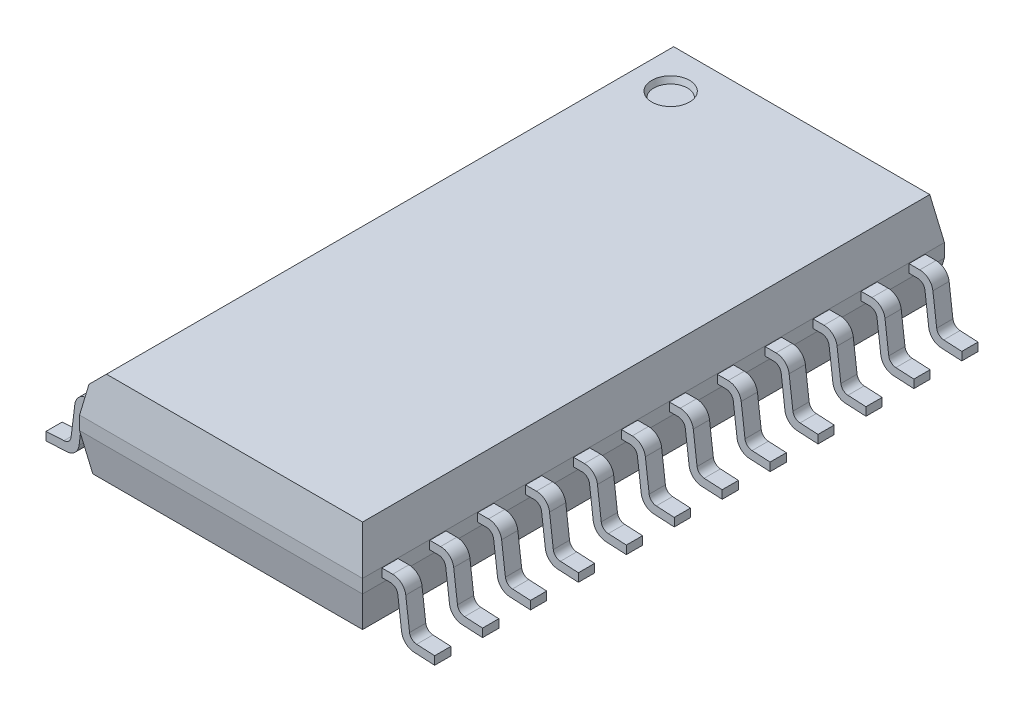
from build123d import *
from OCP.BRepFilletAPI import BRepFilletAPI_MakeChamfer

# Parameters (mm, degrees)
SKETCH1_W            = 7.5
SKETCH1_H            = 15.42
BOSS_EXTRUDE1_DEPTH  = 2.45
CHAMFER1_SIZE        = 0.175
CHAMFER1_SIZE2       = 0.992474318
CHAMFER2_SIZE        = 1.1
CHAMFER2_SIZE2       = 0.193959679
CHAMFER3_SIZE        = 0.4
CHAMFER3_SIZE2       = 0.32446383
SKETCH3_R            = 0.5
MARK_PIN1_DEPTH      = 0.15
MARK_PIN1_DRAFT      = -20
PIN_EXTRUDE_DEPTH    = 0.43
FILLET1_R            = 0.2
FILLET2_R            = 0.35
FILLET1_OF_MIRROR1_R = 0.2
FILLET2_OF_MIRROR1_R = 0.35
PIN_PATTERN_START    = -5.93
PIN_PATTERN_DEPTH    = 0.43
PIN_PATTERN_START_2  = -4.66
PIN_PATTERN_2_DEPTH  = 0.43
PIN_PATTERN_START_3  = -3.39
PIN_PATTERN_3_DEPTH  = 0.43
PIN_PATTERN_START_4  = -2.12
PIN_PATTERN_4_DEPTH  = 0.43
PIN_PATTERN_START_5  = -0.85
PIN_PATTERN_5_DEPTH  = 0.43
PIN_PATTERN_START_6  = 0.42
PIN_PATTERN_6_DEPTH  = 0.43
PIN_PATTERN_START_7  = 1.69
PIN_PATTERN_7_DEPTH  = 0.43
PIN_PATTERN_START_8  = 2.96
PIN_PATTERN_8_DEPTH  = 0.43
PIN_PATTERN_START_9  = 4.23
PIN_PATTERN_9_DEPTH  = 0.43
PIN_PATTERN_START_10 = 5.5
PIN_PATTERN_10_DEPTH = 0.43
PIN_PATTERN_START_11 = 6.77
PIN_PATTERN_11_DEPTH = 0.43


# Read off the part's stored shape, not the designer's step: pin_pattern
with BuildPart() as part:
    # Sketch1 → Boss-Extrude1 (new body)
    with BuildSketch(Plane(origin=(0, 0.2, 0), x_dir=(1, 0, 0), z_dir=(0, 1, 0))):
        Rectangle(SKETCH1_W, SKETCH1_H)
    extrude(amount=BOSS_EXTRUDE1_DEPTH)

    # Chamfer1
    chamfer1_edges = [part.edges().sort_by_distance(p)[0] for p in [
        (0, 0.2, 7.71),
        (-3.75, 0.2, 0),
        (0, 0.2, -7.71),
        (3.75, 0.2, 0),
    ]]
    chamfer1_side = [part.faces().sort_by_distance(p)[0] for p in [
        (0, 0.2, 0),
    ]]
    chamfer(chamfer1_edges, length=CHAMFER1_SIZE, length2=CHAMFER1_SIZE2, reference=chamfer1_side[0])

    # Chamfer2: one chamfer whose edges measure the first distance from different faces: ONE call of the kernel's chamfer builder (chamfer() names one face for all edges)
    chamfer2_edges_1 = [part.edges().sort_by_distance(p)[0] for p in [
        (-3.75, 2.65, 0),
    ]]
    chamfer2_side_1 = [part.faces().sort_by_distance(p)[0] for p in [
        (-3.75, 1.921237159, 0),
    ]]
    chamfer2_edges_2 = [part.edges().sort_by_distance(p)[0] for p in [
        (0, 2.65, 7.71),
    ]]
    chamfer2_side_2 = [part.faces().sort_by_distance(p)[0] for p in [
        (0, 1.921237159, 7.71),
    ]]
    chamfer2_edges_3 = [part.edges().sort_by_distance(p)[0] for p in [
        (3.75, 2.65, 0),
    ]]
    chamfer2_side_3 = [part.faces().sort_by_distance(p)[0] for p in [
        (3.75, 1.921237159, 0),
    ]]
    chamfer2_edges_4 = [part.edges().sort_by_distance(p)[0] for p in [
        (0, 2.65, -7.71),
    ]]
    chamfer2_side_4 = [part.faces().sort_by_distance(p)[0] for p in [
        (0, 1.921237159, -7.71),
    ]]
    chamfer2 = BRepFilletAPI_MakeChamfer(part.part.solid().wrapped)
    for e in chamfer2_edges_1:
        chamfer2.Add(CHAMFER2_SIZE, CHAMFER2_SIZE2, e.wrapped, chamfer2_side_1[0].wrapped)  # the first distance lies on this face
    for e in chamfer2_edges_2:
        chamfer2.Add(CHAMFER2_SIZE, CHAMFER2_SIZE2, e.wrapped, chamfer2_side_2[0].wrapped)  # the first distance lies on this face
    for e in chamfer2_edges_3:
        chamfer2.Add(CHAMFER2_SIZE, CHAMFER2_SIZE2, e.wrapped, chamfer2_side_3[0].wrapped)  # the first distance lies on this face
    for e in chamfer2_edges_4:
        chamfer2.Add(CHAMFER2_SIZE, CHAMFER2_SIZE2, e.wrapped, chamfer2_side_4[0].wrapped)  # the first distance lies on this face
    add(Compound.cast(chamfer2.Shape()), mode=Mode.REPLACE)

    # Chamfer3
    chamfer3_edges = [part.edges().sort_by_distance(p)[0] for p in [
        (-3.556040321, 2.65, 0),
    ]]
    chamfer3_side = [part.faces().sort_by_distance(p)[0] for p in [
        (-3.653431959, 2.097664575, 0),
    ]]
    chamfer(chamfer3_edges, length=CHAMFER3_SIZE, length2=CHAMFER3_SIZE2, reference=chamfer3_side[0])


with BuildPart() as mark_pin1_tool:
    # Sketch3 → mark pin1 (with draft: the straight prism first)
    with BuildSketch(Plane(origin=(0, 2.65, 0), x_dir=(1, 0, 0), z_dir=(0, 1, 0))):
        with Locations((-2.25, 6.455)):
            Circle(SKETCH3_R)
    extrude(amount=-MARK_PIN1_DEPTH)
    # mark pin1: the draft: its side faces are tilted about the plane it starts from
    mark_pin1_sides = [mark_pin1_tool.faces().sort_by_distance(p)[0] for p in [
        (-2.75, 2.575, -6.455),
    ]]
    draft(mark_pin1_sides, Plane(origin=(0, 2.65, 0), x_dir=(1, 0, 0), z_dir=(0, 1, 0)), MARK_PIN1_DRAFT)


with BuildPart() as part_1:
    add(part.part)

    # mark pin1: cut by mark_pin1_tool
    add(mark_pin1_tool.part, mode=Mode.SUBTRACT)

    # Sketch2 → pin extrude (add)
    with BuildSketch(Plane(origin=(0, 0, -7.2), x_dir=(-1, 0, 0), z_dir=(0, 0, -1))):
        Polygon((5.15, 0), (5.15, 0.22), (4.505650355, 0.253768934), (4.34659533, 1.535), (0, 1.535), (0, 1.315), (4.152217882, 1.315), (4.31, 0.044022535), align=None)
    pin_extrude = extrude(amount=-PIN_EXTRUDE_DEPTH)

    # Fillet1
    fillet1_edges = [part_1.edges().sort_by_distance(p)[0] for p in [
        (-4.152217882, 1.315, -6.985),
        (-4.505650355, 0.253768934, -6.985),
    ]]
    fillet(fillet1_edges, radius=FILLET1_R)

    # Fillet2
    fillet2_edges = [part_1.edges().sort_by_distance(p)[0] for p in [
        (-4.31, 0.044022535, -6.985),
        (-4.34659533, 1.535, -6.985),
    ]]
    fillet(fillet2_edges, radius=FILLET2_R)

    # Mirror1: pin extrude across plane
    add(pin_extrude.mirror(Plane(origin=(0, 0, 0), x_dir=(0, 0, 1), z_dir=(1, 0, 0))))

    # Fillet1 of Mirror1
    fillet1_of_mirror1_edges = [part_1.edges().sort_by_distance(p)[0] for p in [
        (4.152217882, 1.315, -6.985),
        (4.505650355, 0.253768934, -6.985),
    ]]
    fillet(fillet1_of_mirror1_edges, radius=FILLET1_OF_MIRROR1_R)

    # Fillet2 of Mirror1
    fillet2_of_mirror1_edges = [part_1.edges().sort_by_distance(p)[0] for p in [
        (4.31, 0.044022535, -6.985),
        (4.34659533, 1.535, -6.985),
    ]]
    fillet(fillet2_of_mirror1_edges, radius=FILLET2_OF_MIRROR1_R)

    # pin_pattern outline → pin_pattern (add)
    with BuildSketch(Plane.XY.offset(PIN_PATTERN_START)):
        with BuildLine():
            Line((3.75, 1.315), (3.97551111, 1.315))
            ThreePointArc((3.97551111, 1.315), (4.107934925, 1.264879729), (4.173987566, 1.139639332))
            Line((4.173987566, 1.139639332), (4.273868112, 0.335074624))
            ThreePointArc((4.273868112, 0.335074624), (4.382673705, 0.122060099), (4.602884324, 0.028673118))
            Line((4.602884324, 0.028673118), (5.15, 0))
            Line((5.15, 0), (5.15, 0.22))
            Line((5.15, 0.22), (4.673012826, 0.244997839))
            ThreePointArc((4.673012826, 0.244997839), (4.547178186, 0.298361828), (4.485003562, 0.420084414))
            Line((4.485003562, 0.420084414), (4.384692277, 1.228118831))
            ThreePointArc((4.384692277, 1.228118831), (4.269100157, 1.447289526), (4.03735848, 1.535))
            Line((4.03735848, 1.535), (3.75, 1.535))
            Line((3.75, 1.535), (3.75, 1.315))
        make_face()
        with BuildLine():
            ThreePointArc((-4.173987566, 1.139639332), (-4.107934925, 1.264879729), (-3.97551111, 1.315))
            Line((-3.97551111, 1.315), (-3.75, 1.315))
            Line((-3.75, 1.315), (-3.75, 1.535))
            Line((-3.75, 1.535), (-4.03735848, 1.535))
            ThreePointArc((-4.03735848, 1.535), (-4.269100157, 1.447289526), (-4.384692277, 1.228118831))
            Line((-4.384692277, 1.228118831), (-4.485003562, 0.420084414))
            ThreePointArc((-4.485003562, 0.420084414), (-4.547178186, 0.298361828), (-4.673012826, 0.244997839))
            Line((-4.673012826, 0.244997839), (-5.15, 0.22))
            Line((-5.15, 0.22), (-5.15, 0))
            Line((-5.15, 0), (-4.602884324, 0.028673118))
            ThreePointArc((-4.602884324, 0.028673118), (-4.382673705, 0.122060099), (-4.273868112, 0.335074624))
            Line((-4.273868112, 0.335074624), (-4.173987566, 1.139639332))
        make_face()
    extrude(amount=PIN_PATTERN_DEPTH)

    # pin_pattern 2 outline → pin_pattern 2 (add)
    with BuildSketch(Plane.XY.offset(PIN_PATTERN_START_2)):
        with BuildLine():
            Line((3.75, 1.315), (3.97551111, 1.315))
            ThreePointArc((3.97551111, 1.315), (4.107934925, 1.264879729), (4.173987566, 1.139639332))
            Line((4.173987566, 1.139639332), (4.273868112, 0.335074624))
            ThreePointArc((4.273868112, 0.335074624), (4.382673705, 0.122060099), (4.602884324, 0.028673118))
            Line((4.602884324, 0.028673118), (5.15, 0))
            Line((5.15, 0), (5.15, 0.22))
            Line((5.15, 0.22), (4.673012826, 0.244997839))
            ThreePointArc((4.673012826, 0.244997839), (4.547178186, 0.298361828), (4.485003562, 0.420084414))
            Line((4.485003562, 0.420084414), (4.384692277, 1.228118831))
            ThreePointArc((4.384692277, 1.228118831), (4.269100157, 1.447289526), (4.03735848, 1.535))
            Line((4.03735848, 1.535), (3.75, 1.535))
            Line((3.75, 1.535), (3.75, 1.315))
        make_face()
        with BuildLine():
            ThreePointArc((-4.173987566, 1.139639332), (-4.107934925, 1.264879729), (-3.97551111, 1.315))
            Line((-3.97551111, 1.315), (-3.75, 1.315))
            Line((-3.75, 1.315), (-3.75, 1.535))
            Line((-3.75, 1.535), (-4.03735848, 1.535))
            ThreePointArc((-4.03735848, 1.535), (-4.269100157, 1.447289526), (-4.384692277, 1.228118831))
            Line((-4.384692277, 1.228118831), (-4.485003562, 0.420084414))
            ThreePointArc((-4.485003562, 0.420084414), (-4.547178186, 0.298361828), (-4.673012826, 0.244997839))
            Line((-4.673012826, 0.244997839), (-5.15, 0.22))
            Line((-5.15, 0.22), (-5.15, 0))
            Line((-5.15, 0), (-4.602884324, 0.028673118))
            ThreePointArc((-4.602884324, 0.028673118), (-4.382673705, 0.122060099), (-4.273868112, 0.335074624))
            Line((-4.273868112, 0.335074624), (-4.173987566, 1.139639332))
        make_face()
    extrude(amount=PIN_PATTERN_2_DEPTH)

    # pin_pattern 3 outline → pin_pattern 3 (add)
    with BuildSketch(Plane.XY.offset(PIN_PATTERN_START_3)):
        with BuildLine():
            Line((3.75, 1.315), (3.97551111, 1.315))
            ThreePointArc((3.97551111, 1.315), (4.107934925, 1.264879729), (4.173987566, 1.139639332))
            Line((4.173987566, 1.139639332), (4.273868112, 0.335074624))
            ThreePointArc((4.273868112, 0.335074624), (4.382673705, 0.122060099), (4.602884324, 0.028673118))
            Line((4.602884324, 0.028673118), (5.15, 0))
            Line((5.15, 0), (5.15, 0.22))
            Line((5.15, 0.22), (4.673012826, 0.244997839))
            ThreePointArc((4.673012826, 0.244997839), (4.547178186, 0.298361828), (4.485003562, 0.420084414))
            Line((4.485003562, 0.420084414), (4.384692277, 1.228118831))
            ThreePointArc((4.384692277, 1.228118831), (4.269100157, 1.447289526), (4.03735848, 1.535))
            Line((4.03735848, 1.535), (3.75, 1.535))
            Line((3.75, 1.535), (3.75, 1.315))
        make_face()
        with BuildLine():
            ThreePointArc((-4.173987566, 1.139639332), (-4.107934925, 1.264879729), (-3.97551111, 1.315))
            Line((-3.97551111, 1.315), (-3.75, 1.315))
            Line((-3.75, 1.315), (-3.75, 1.535))
            Line((-3.75, 1.535), (-4.03735848, 1.535))
            ThreePointArc((-4.03735848, 1.535), (-4.269100157, 1.447289526), (-4.384692277, 1.228118831))
            Line((-4.384692277, 1.228118831), (-4.485003562, 0.420084414))
            ThreePointArc((-4.485003562, 0.420084414), (-4.547178186, 0.298361828), (-4.673012826, 0.244997839))
            Line((-4.673012826, 0.244997839), (-5.15, 0.22))
            Line((-5.15, 0.22), (-5.15, 0))
            Line((-5.15, 0), (-4.602884324, 0.028673118))
            ThreePointArc((-4.602884324, 0.028673118), (-4.382673705, 0.122060099), (-4.273868112, 0.335074624))
            Line((-4.273868112, 0.335074624), (-4.173987566, 1.139639332))
        make_face()
    extrude(amount=PIN_PATTERN_3_DEPTH)

    # pin_pattern 4 outline → pin_pattern 4 (add)
    with BuildSketch(Plane.XY.offset(PIN_PATTERN_START_4)):
        with BuildLine():
            Line((3.75, 1.315), (3.97551111, 1.315))
            ThreePointArc((3.97551111, 1.315), (4.107934925, 1.264879729), (4.173987566, 1.139639332))
            Line((4.173987566, 1.139639332), (4.273868112, 0.335074624))
            ThreePointArc((4.273868112, 0.335074624), (4.382673705, 0.122060099), (4.602884324, 0.028673118))
            Line((4.602884324, 0.028673118), (5.15, 0))
            Line((5.15, 0), (5.15, 0.22))
            Line((5.15, 0.22), (4.673012826, 0.244997839))
            ThreePointArc((4.673012826, 0.244997839), (4.547178186, 0.298361828), (4.485003562, 0.420084414))
            Line((4.485003562, 0.420084414), (4.384692277, 1.228118831))
            ThreePointArc((4.384692277, 1.228118831), (4.269100157, 1.447289526), (4.03735848, 1.535))
            Line((4.03735848, 1.535), (3.75, 1.535))
            Line((3.75, 1.535), (3.75, 1.315))
        make_face()
        with BuildLine():
            ThreePointArc((-4.173987566, 1.139639332), (-4.107934925, 1.264879729), (-3.97551111, 1.315))
            Line((-3.97551111, 1.315), (-3.75, 1.315))
            Line((-3.75, 1.315), (-3.75, 1.535))
            Line((-3.75, 1.535), (-4.03735848, 1.535))
            ThreePointArc((-4.03735848, 1.535), (-4.269100157, 1.447289526), (-4.384692277, 1.228118831))
            Line((-4.384692277, 1.228118831), (-4.485003562, 0.420084414))
            ThreePointArc((-4.485003562, 0.420084414), (-4.547178186, 0.298361828), (-4.673012826, 0.244997839))
            Line((-4.673012826, 0.244997839), (-5.15, 0.22))
            Line((-5.15, 0.22), (-5.15, 0))
            Line((-5.15, 0), (-4.602884324, 0.028673118))
            ThreePointArc((-4.602884324, 0.028673118), (-4.382673705, 0.122060099), (-4.273868112, 0.335074624))
            Line((-4.273868112, 0.335074624), (-4.173987566, 1.139639332))
        make_face()
    extrude(amount=PIN_PATTERN_4_DEPTH)

    # pin_pattern 5 outline → pin_pattern 5 (add)
    with BuildSketch(Plane.XY.offset(PIN_PATTERN_START_5)):
        with BuildLine():
            Line((3.75, 1.315), (3.97551111, 1.315))
            ThreePointArc((3.97551111, 1.315), (4.107934925, 1.264879729), (4.173987566, 1.139639332))
            Line((4.173987566, 1.139639332), (4.273868112, 0.335074624))
            ThreePointArc((4.273868112, 0.335074624), (4.382673705, 0.122060099), (4.602884324, 0.028673118))
            Line((4.602884324, 0.028673118), (5.15, 0))
            Line((5.15, 0), (5.15, 0.22))
            Line((5.15, 0.22), (4.673012826, 0.244997839))
            ThreePointArc((4.673012826, 0.244997839), (4.547178186, 0.298361828), (4.485003562, 0.420084414))
            Line((4.485003562, 0.420084414), (4.384692277, 1.228118831))
            ThreePointArc((4.384692277, 1.228118831), (4.269100157, 1.447289526), (4.03735848, 1.535))
            Line((4.03735848, 1.535), (3.75, 1.535))
            Line((3.75, 1.535), (3.75, 1.315))
        make_face()
        with BuildLine():
            ThreePointArc((-4.173987566, 1.139639332), (-4.107934925, 1.264879729), (-3.97551111, 1.315))
            Line((-3.97551111, 1.315), (-3.75, 1.315))
            Line((-3.75, 1.315), (-3.75, 1.535))
            Line((-3.75, 1.535), (-4.03735848, 1.535))
            ThreePointArc((-4.03735848, 1.535), (-4.269100157, 1.447289526), (-4.384692277, 1.228118831))
            Line((-4.384692277, 1.228118831), (-4.485003562, 0.420084414))
            ThreePointArc((-4.485003562, 0.420084414), (-4.547178186, 0.298361828), (-4.673012826, 0.244997839))
            Line((-4.673012826, 0.244997839), (-5.15, 0.22))
            Line((-5.15, 0.22), (-5.15, 0))
            Line((-5.15, 0), (-4.602884324, 0.028673118))
            ThreePointArc((-4.602884324, 0.028673118), (-4.382673705, 0.122060099), (-4.273868112, 0.335074624))
            Line((-4.273868112, 0.335074624), (-4.173987566, 1.139639332))
        make_face()
    extrude(amount=PIN_PATTERN_5_DEPTH)

    # pin_pattern 6 outline → pin_pattern 6 (add)
    with BuildSketch(Plane.XY.offset(PIN_PATTERN_START_6)):
        with BuildLine():
            Line((3.75, 1.315), (3.97551111, 1.315))
            ThreePointArc((3.97551111, 1.315), (4.107934925, 1.264879729), (4.173987566, 1.139639332))
            Line((4.173987566, 1.139639332), (4.273868112, 0.335074624))
            ThreePointArc((4.273868112, 0.335074624), (4.382673705, 0.122060099), (4.602884324, 0.028673118))
            Line((4.602884324, 0.028673118), (5.15, 0))
            Line((5.15, 0), (5.15, 0.22))
            Line((5.15, 0.22), (4.673012826, 0.244997839))
            ThreePointArc((4.673012826, 0.244997839), (4.547178186, 0.298361828), (4.485003562, 0.420084414))
            Line((4.485003562, 0.420084414), (4.384692277, 1.228118831))
            ThreePointArc((4.384692277, 1.228118831), (4.269100157, 1.447289526), (4.03735848, 1.535))
            Line((4.03735848, 1.535), (3.75, 1.535))
            Line((3.75, 1.535), (3.75, 1.315))
        make_face()
        with BuildLine():
            ThreePointArc((-4.173987566, 1.139639332), (-4.107934925, 1.264879729), (-3.97551111, 1.315))
            Line((-3.97551111, 1.315), (-3.75, 1.315))
            Line((-3.75, 1.315), (-3.75, 1.535))
            Line((-3.75, 1.535), (-4.03735848, 1.535))
            ThreePointArc((-4.03735848, 1.535), (-4.269100157, 1.447289526), (-4.384692277, 1.228118831))
            Line((-4.384692277, 1.228118831), (-4.485003562, 0.420084414))
            ThreePointArc((-4.485003562, 0.420084414), (-4.547178186, 0.298361828), (-4.673012826, 0.244997839))
            Line((-4.673012826, 0.244997839), (-5.15, 0.22))
            Line((-5.15, 0.22), (-5.15, 0))
            Line((-5.15, 0), (-4.602884324, 0.028673118))
            ThreePointArc((-4.602884324, 0.028673118), (-4.382673705, 0.122060099), (-4.273868112, 0.335074624))
            Line((-4.273868112, 0.335074624), (-4.173987566, 1.139639332))
        make_face()
    extrude(amount=PIN_PATTERN_6_DEPTH)

    # pin_pattern 7 outline → pin_pattern 7 (add)
    with BuildSketch(Plane.XY.offset(PIN_PATTERN_START_7)):
        with BuildLine():
            Line((3.75, 1.315), (3.97551111, 1.315))
            ThreePointArc((3.97551111, 1.315), (4.107934925, 1.264879729), (4.173987566, 1.139639332))
            Line((4.173987566, 1.139639332), (4.273868112, 0.335074624))
            ThreePointArc((4.273868112, 0.335074624), (4.382673705, 0.122060099), (4.602884324, 0.028673118))
            Line((4.602884324, 0.028673118), (5.15, 0))
            Line((5.15, 0), (5.15, 0.22))
            Line((5.15, 0.22), (4.673012826, 0.244997839))
            ThreePointArc((4.673012826, 0.244997839), (4.547178186, 0.298361828), (4.485003562, 0.420084414))
            Line((4.485003562, 0.420084414), (4.384692277, 1.228118831))
            ThreePointArc((4.384692277, 1.228118831), (4.269100157, 1.447289526), (4.03735848, 1.535))
            Line((4.03735848, 1.535), (3.75, 1.535))
            Line((3.75, 1.535), (3.75, 1.315))
        make_face()
        with BuildLine():
            ThreePointArc((-4.173987566, 1.139639332), (-4.107934925, 1.264879729), (-3.97551111, 1.315))
            Line((-3.97551111, 1.315), (-3.75, 1.315))
            Line((-3.75, 1.315), (-3.75, 1.535))
            Line((-3.75, 1.535), (-4.03735848, 1.535))
            ThreePointArc((-4.03735848, 1.535), (-4.269100157, 1.447289526), (-4.384692277, 1.228118831))
            Line((-4.384692277, 1.228118831), (-4.485003562, 0.420084414))
            ThreePointArc((-4.485003562, 0.420084414), (-4.547178186, 0.298361828), (-4.673012826, 0.244997839))
            Line((-4.673012826, 0.244997839), (-5.15, 0.22))
            Line((-5.15, 0.22), (-5.15, 0))
            Line((-5.15, 0), (-4.602884324, 0.028673118))
            ThreePointArc((-4.602884324, 0.028673118), (-4.382673705, 0.122060099), (-4.273868112, 0.335074624))
            Line((-4.273868112, 0.335074624), (-4.173987566, 1.139639332))
        make_face()
    extrude(amount=PIN_PATTERN_7_DEPTH)

    # pin_pattern 8 outline → pin_pattern 8 (add)
    with BuildSketch(Plane.XY.offset(PIN_PATTERN_START_8)):
        with BuildLine():
            Line((3.75, 1.315), (3.97551111, 1.315))
            ThreePointArc((3.97551111, 1.315), (4.107934925, 1.264879729), (4.173987566, 1.139639332))
            Line((4.173987566, 1.139639332), (4.273868112, 0.335074624))
            ThreePointArc((4.273868112, 0.335074624), (4.382673705, 0.122060099), (4.602884324, 0.028673118))
            Line((4.602884324, 0.028673118), (5.15, 0))
            Line((5.15, 0), (5.15, 0.22))
            Line((5.15, 0.22), (4.673012826, 0.244997839))
            ThreePointArc((4.673012826, 0.244997839), (4.547178186, 0.298361828), (4.485003562, 0.420084414))
            Line((4.485003562, 0.420084414), (4.384692277, 1.228118831))
            ThreePointArc((4.384692277, 1.228118831), (4.269100157, 1.447289526), (4.03735848, 1.535))
            Line((4.03735848, 1.535), (3.75, 1.535))
            Line((3.75, 1.535), (3.75, 1.315))
        make_face()
        with BuildLine():
            ThreePointArc((-4.173987566, 1.139639332), (-4.107934925, 1.264879729), (-3.97551111, 1.315))
            Line((-3.97551111, 1.315), (-3.75, 1.315))
            Line((-3.75, 1.315), (-3.75, 1.535))
            Line((-3.75, 1.535), (-4.03735848, 1.535))
            ThreePointArc((-4.03735848, 1.535), (-4.269100157, 1.447289526), (-4.384692277, 1.228118831))
            Line((-4.384692277, 1.228118831), (-4.485003562, 0.420084414))
            ThreePointArc((-4.485003562, 0.420084414), (-4.547178186, 0.298361828), (-4.673012826, 0.244997839))
            Line((-4.673012826, 0.244997839), (-5.15, 0.22))
            Line((-5.15, 0.22), (-5.15, 0))
            Line((-5.15, 0), (-4.602884324, 0.028673118))
            ThreePointArc((-4.602884324, 0.028673118), (-4.382673705, 0.122060099), (-4.273868112, 0.335074624))
            Line((-4.273868112, 0.335074624), (-4.173987566, 1.139639332))
        make_face()
    extrude(amount=PIN_PATTERN_8_DEPTH)

    # pin_pattern 9 outline → pin_pattern 9 (add)
    with BuildSketch(Plane.XY.offset(PIN_PATTERN_START_9)):
        with BuildLine():
            Line((3.75, 1.315), (3.97551111, 1.315))
            ThreePointArc((3.97551111, 1.315), (4.107934925, 1.264879729), (4.173987566, 1.139639332))
            Line((4.173987566, 1.139639332), (4.273868112, 0.335074624))
            ThreePointArc((4.273868112, 0.335074624), (4.382673705, 0.122060099), (4.602884324, 0.028673118))
            Line((4.602884324, 0.028673118), (5.15, 0))
            Line((5.15, 0), (5.15, 0.22))
            Line((5.15, 0.22), (4.673012826, 0.244997839))
            ThreePointArc((4.673012826, 0.244997839), (4.547178186, 0.298361828), (4.485003562, 0.420084414))
            Line((4.485003562, 0.420084414), (4.384692277, 1.228118831))
            ThreePointArc((4.384692277, 1.228118831), (4.269100157, 1.447289526), (4.03735848, 1.535))
            Line((4.03735848, 1.535), (3.75, 1.535))
            Line((3.75, 1.535), (3.75, 1.315))
        make_face()
        with BuildLine():
            ThreePointArc((-4.173987566, 1.139639332), (-4.107934925, 1.264879729), (-3.97551111, 1.315))
            Line((-3.97551111, 1.315), (-3.75, 1.315))
            Line((-3.75, 1.315), (-3.75, 1.535))
            Line((-3.75, 1.535), (-4.03735848, 1.535))
            ThreePointArc((-4.03735848, 1.535), (-4.269100157, 1.447289526), (-4.384692277, 1.228118831))
            Line((-4.384692277, 1.228118831), (-4.485003562, 0.420084414))
            ThreePointArc((-4.485003562, 0.420084414), (-4.547178186, 0.298361828), (-4.673012826, 0.244997839))
            Line((-4.673012826, 0.244997839), (-5.15, 0.22))
            Line((-5.15, 0.22), (-5.15, 0))
            Line((-5.15, 0), (-4.602884324, 0.028673118))
            ThreePointArc((-4.602884324, 0.028673118), (-4.382673705, 0.122060099), (-4.273868112, 0.335074624))
            Line((-4.273868112, 0.335074624), (-4.173987566, 1.139639332))
        make_face()
    extrude(amount=PIN_PATTERN_9_DEPTH)

    # pin_pattern 10 outline → pin_pattern 10 (add)
    with BuildSketch(Plane.XY.offset(PIN_PATTERN_START_10)):
        with BuildLine():
            Line((3.75, 1.315), (3.97551111, 1.315))
            ThreePointArc((3.97551111, 1.315), (4.107934925, 1.264879729), (4.173987566, 1.139639332))
            Line((4.173987566, 1.139639332), (4.273868112, 0.335074624))
            ThreePointArc((4.273868112, 0.335074624), (4.382673705, 0.122060099), (4.602884324, 0.028673118))
            Line((4.602884324, 0.028673118), (5.15, 0))
            Line((5.15, 0), (5.15, 0.22))
            Line((5.15, 0.22), (4.673012826, 0.244997839))
            ThreePointArc((4.673012826, 0.244997839), (4.547178186, 0.298361828), (4.485003562, 0.420084414))
            Line((4.485003562, 0.420084414), (4.384692277, 1.228118831))
            ThreePointArc((4.384692277, 1.228118831), (4.269100157, 1.447289526), (4.03735848, 1.535))
            Line((4.03735848, 1.535), (3.75, 1.535))
            Line((3.75, 1.535), (3.75, 1.315))
        make_face()
        with BuildLine():
            ThreePointArc((-4.173987566, 1.139639332), (-4.107934925, 1.264879729), (-3.97551111, 1.315))
            Line((-3.97551111, 1.315), (-3.75, 1.315))
            Line((-3.75, 1.315), (-3.75, 1.535))
            Line((-3.75, 1.535), (-4.03735848, 1.535))
            ThreePointArc((-4.03735848, 1.535), (-4.269100157, 1.447289526), (-4.384692277, 1.228118831))
            Line((-4.384692277, 1.228118831), (-4.485003562, 0.420084414))
            ThreePointArc((-4.485003562, 0.420084414), (-4.547178186, 0.298361828), (-4.673012826, 0.244997839))
            Line((-4.673012826, 0.244997839), (-5.15, 0.22))
            Line((-5.15, 0.22), (-5.15, 0))
            Line((-5.15, 0), (-4.602884324, 0.028673118))
            ThreePointArc((-4.602884324, 0.028673118), (-4.382673705, 0.122060099), (-4.273868112, 0.335074624))
            Line((-4.273868112, 0.335074624), (-4.173987566, 1.139639332))
        make_face()
    extrude(amount=PIN_PATTERN_10_DEPTH)

    # pin_pattern 11 outline → pin_pattern 11 (add)
    with BuildSketch(Plane.XY.offset(PIN_PATTERN_START_11)):
        with BuildLine():
            Line((3.75, 1.315), (3.97551111, 1.315))
            ThreePointArc((3.97551111, 1.315), (4.107934925, 1.264879729), (4.173987566, 1.139639332))
            Line((4.173987566, 1.139639332), (4.273868112, 0.335074624))
            ThreePointArc((4.273868112, 0.335074624), (4.382673705, 0.122060099), (4.602884324, 0.028673118))
            Line((4.602884324, 0.028673118), (5.15, 0))
            Line((5.15, 0), (5.15, 0.22))
            Line((5.15, 0.22), (4.673012826, 0.244997839))
            ThreePointArc((4.673012826, 0.244997839), (4.547178186, 0.298361828), (4.485003562, 0.420084414))
            Line((4.485003562, 0.420084414), (4.384692277, 1.228118831))
            ThreePointArc((4.384692277, 1.228118831), (4.269100157, 1.447289526), (4.03735848, 1.535))
            Line((4.03735848, 1.535), (3.75, 1.535))
            Line((3.75, 1.535), (3.75, 1.315))
        make_face()
        with BuildLine():
            ThreePointArc((-4.173987566, 1.139639332), (-4.107934925, 1.264879729), (-3.97551111, 1.315))
            Line((-3.97551111, 1.315), (-3.75, 1.315))
            Line((-3.75, 1.315), (-3.75, 1.535))
            Line((-3.75, 1.535), (-4.03735848, 1.535))
            ThreePointArc((-4.03735848, 1.535), (-4.269100157, 1.447289526), (-4.384692277, 1.228118831))
            Line((-4.384692277, 1.228118831), (-4.485003562, 0.420084414))
            ThreePointArc((-4.485003562, 0.420084414), (-4.547178186, 0.298361828), (-4.673012826, 0.244997839))
            Line((-4.673012826, 0.244997839), (-5.15, 0.22))
            Line((-5.15, 0.22), (-5.15, 0))
            Line((-5.15, 0), (-4.602884324, 0.028673118))
            ThreePointArc((-4.602884324, 0.028673118), (-4.382673705, 0.122060099), (-4.273868112, 0.335074624))
            Line((-4.273868112, 0.335074624), (-4.173987566, 1.139639332))
        make_face()
    extrude(amount=PIN_PATTERN_11_DEPTH)


solid = part_1.part
